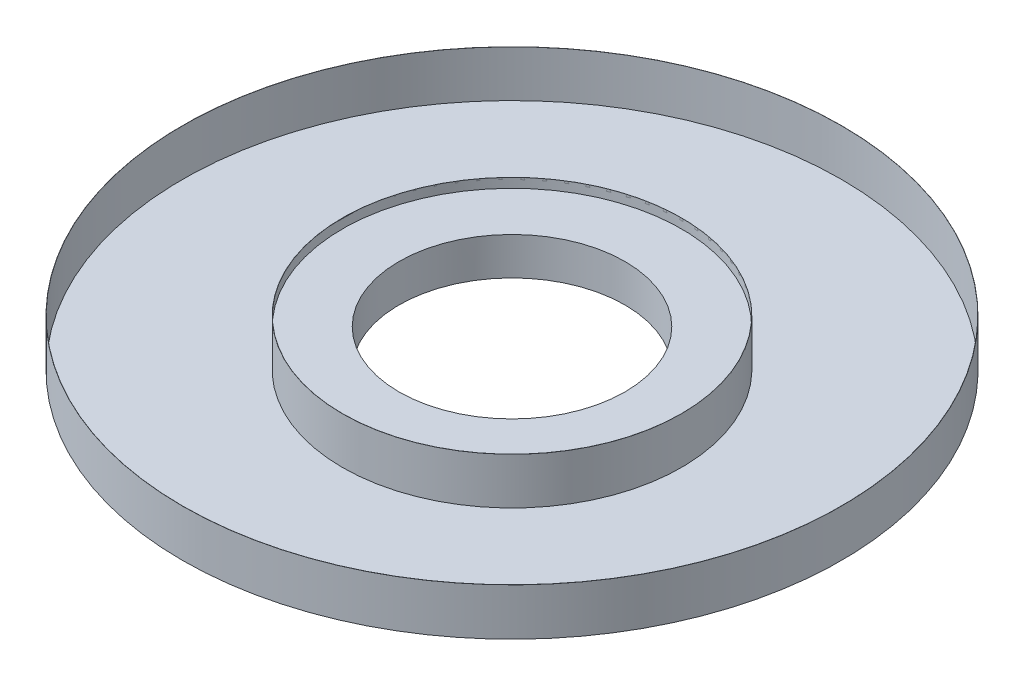
from build123d import *

# Parameters (mm, degrees)
SKETCH1_R               = 1750
BOSS_EXTRUDE1_DEPTH     = 500
SKETCH2_R               = 900
CUT_EXTRUDE2_DEPTH      = 300
SKETCH3_R               = 600
CUT_EXTRUDE3_DEPTH      = 300
SKETCH4_R               = 1749.25
SKETCH4_R_2             = 900.75
CUT_EXTRUDE4_DEPTH      = 497
CUT_EXTRUDE5_DEPTH      = 2525.876234591
CUT_EXTRUDE5_DEPTH_BACK = 2525.876234591


with BuildPart() as part:
    # Sketch1 → Boss-Extrude1 (new body)
    with BuildSketch(Plane(origin=(0, 0, 0), x_dir=(1, 0, 0), z_dir=(0, 1, 0))):
        Circle(SKETCH1_R)
    extrude(amount=BOSS_EXTRUDE1_DEPTH)

    # Sketch2 → Cut-Extrude2 (cut)
    with BuildSketch(Plane(origin=(0, 500, 0), x_dir=(1, 0, 0), z_dir=(0, 1, 0))):
        Circle(SKETCH2_R)
    extrude(amount=-CUT_EXTRUDE2_DEPTH, mode=Mode.SUBTRACT)

    # Sketch3 → Cut-Extrude3 (cut)
    with BuildSketch(Plane.XZ):
        Circle(SKETCH3_R)
    extrude(amount=-CUT_EXTRUDE3_DEPTH, mode=Mode.SUBTRACT)

    # Sketch4 → Cut-Extrude4 (cut)
    with BuildSketch(Plane(origin=(0, 500, 0), x_dir=(1, 0, 0), z_dir=(0, 1, 0))):
        Circle(SKETCH4_R)
        Circle(SKETCH4_R_2, mode=Mode.SUBTRACT)
    extrude(amount=-CUT_EXTRUDE4_DEPTH, mode=Mode.SUBTRACT)

    # Sketch6 → Cut-Extrude5 (cut, two sides: drawn at the far end of the back side and taken through both)
    with BuildSketch(Plane(origin=(0, 0, 0), x_dir=(0, 0, -1), z_dir=(1, 0, 0)).offset(-CUT_EXTRUDE5_DEPTH_BACK)):
        Polygon((-1750, 250), (0, 250), (1750, 250), (1750, 500), (-1750, 500), align=None)
    extrude(amount=CUT_EXTRUDE5_DEPTH + CUT_EXTRUDE5_DEPTH_BACK, mode=Mode.SUBTRACT)


solid = part.part
